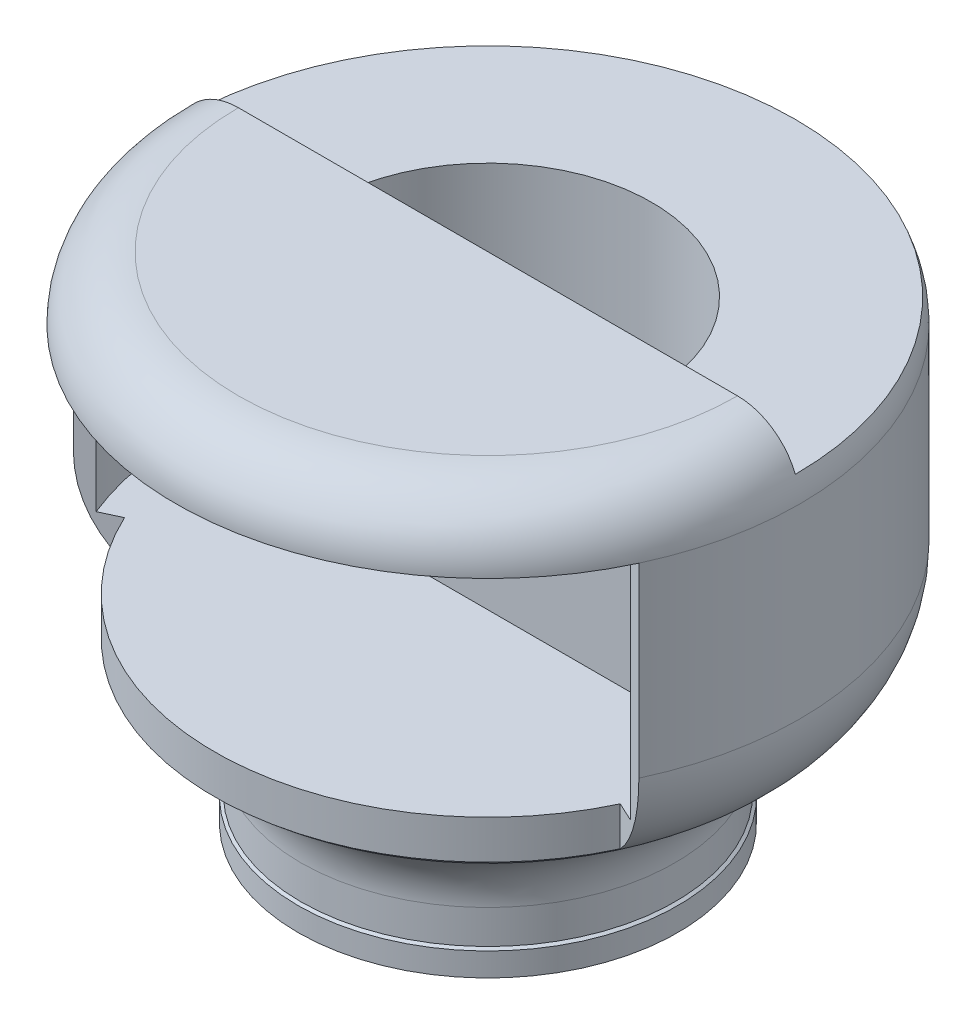
from build123d import *

# Parameters (mm, degrees)
CUT_EXTRUDE3_DEPTH           = 60
CUT_EXTRUDE5_DEPTH           = 2
CUT_EXTRUDE5_DEPTH_BACK      = 30
SKETCH19_W                   = 12
SKETCH19_H                   = 36.5
CUT_REVOLVE2_ANGLE           = 65
CUT_REVOLVE2_OTHER_WAY_ANGLE = 65
SKETCH21_W                   = 3.25
SKETCH21_H                   = 4
BOSS_EXTRUDE3_DEPTH          = 1.35
CIRPATTERN1_COUNT            = 5
CUT_EXTRUDE9_START           = -5
CUT_EXTRUDE9_DEPTH           = 5


with BuildPart() as part:
    # Sketch1 → Revolve1 (revolve)
    with BuildSketch(Plane.XY):
        with BuildLine():
            Line((0, 63.427876097), (32, 63.427876097))
            ThreePointArc((32, 63.427876097), (37.656854249, 61.084730346), (40, 55.427876097))
            Line((40, 55.427876097), (40, 31.556288966))
            ThreePointArc((40, 31.556288966), (38.188122658, 24.409721904), (33.190210564, 18.989648567))
            Line((33.190210564, 18.989648567), (28.539859624, 15.958818353))
            ThreePointArc((28.539859624, 15.958818353), (25.207918228, 12.345436129), (24, 7.581058088))
            Line((24, 7.581058088), (24, 3.25))
            Line((24, 3.25), (24.35, 3))
            Line((24.35, 3), (24.35, 0))
            Line((24.35, 0), (22.5, 0))
            Line((22.5, 0), (22.5, 12.5))
            ThreePointArc((22.5, 12.5), (22.353553391, 12.853553391), (22, 13))
            Line((22, 13), (0, 13))
            Line((0, 13), (0, 63.427876097))
        make_face()
    revolve(axis=Axis((0, 0, 0), (0, 1, 0)))

    # Sketch11 → Cut-Extrude3 (cut)
    with BuildSketch(Plane(origin=(0, 13, 0), x_dir=(-1, 0, 0), z_dir=(0, -1, 0))):
        with BuildLine():
            Line((-21, 0), (21, 0))
            ThreePointArc((21, 0), (0, 21), (-21, 0))
        make_face()
    extrude(amount=-CUT_EXTRUDE3_DEPTH, mode=Mode.SUBTRACT)

    # Sketch9 → Cut-Extrude5 (cut, two sides: drawn at the far end of the back side and taken through both)
    with BuildSketch(Plane(origin=(0, 55.427876097, 0), x_dir=(1, 0, 0), z_dir=(0, 1, 0)).offset(-CUT_EXTRUDE5_DEPTH_BACK)):
        with BuildLine():
            ThreePointArc((-37, -1.601545046), (-0.398454954, -39), (37, -2.398454954))
            ThreePointArc((37, -2.398454954), (0.398454954, 35), (-37, -1.601545046))
        make_face()
        with BuildLine():
            Line((-24, -1.763080838), (24, -1.763080838))
            ThreePointArc((24, -1.763080838), (0, 24), (-24, -1.763080838))
        make_face(mode=Mode.SUBTRACT)
    extrude(amount=CUT_EXTRUDE5_DEPTH + CUT_EXTRUDE5_DEPTH_BACK, mode=Mode.SUBTRACT)

    # Sketch19 → Cut-Revolve2 (revolve, cut)
    with BuildSketch(Plane(origin=(0, 0, 0), x_dir=(0, 0, -1), z_dir=(1, 0, 0))):
        with Locations((-41.064715832, 37.177876097)):
            Rectangle(SKETCH19_W, SKETCH19_H)
    revolve(axis=Axis((0, 0, 0), (0, 1, 0)), revolution_arc=CUT_REVOLVE2_ANGLE, mode=Mode.SUBTRACT)

    # Sketch19 → Cut-Revolve2 other way (revolve, cut)
    with BuildSketch(Plane(origin=(0, 0, 0), x_dir=(0, 0, -1), z_dir=(1, 0, 0))):
        with Locations((-41.064715832, 37.177876097)):
            Rectangle(SKETCH19_W, SKETCH19_H)
    revolve(axis=Axis((0, 0, 0), (0, -1, 0)), revolution_arc=CUT_REVOLVE2_OTHER_WAY_ANGLE, mode=Mode.SUBTRACT)

    # Sketch21 → Boss-Extrude3 (add)
    with BuildSketch(Plane(origin=(0, 0, 22.5), x_dir=(-1, 0, 0), z_dir=(0, 0, -1))):
        with Locations((0, 2)):
            Rectangle(SKETCH21_W, SKETCH21_H)
    boss_extrude3 = extrude(amount=BOSS_EXTRUDE3_DEPTH)

    # CirPattern1: Boss-Extrude3 ×5 about axis
    cirpattern1_axis = Axis((0, 0, 0), (0, -1, 0))
    for i in range(1, CIRPATTERN1_COUNT):
        add(boss_extrude3.rotate(cirpattern1_axis, i * 360 / CIRPATTERN1_COUNT))

    # Sketch22 → Cut-Extrude9 (cut)
    with BuildSketch(Plane(origin=(0, 63.427876097, 0), x_dir=(1, 0, 0), z_dir=(0, 1, 0)).offset(CUT_EXTRUDE9_START)):
        with BuildLine():
            Line((-40, 0), (40, 0))
            ThreePointArc((40, 0), (0, 40), (-40, 0))
        make_face()
    extrude(amount=CUT_EXTRUDE9_DEPTH, mode=Mode.SUBTRACT)


solid = part.part
